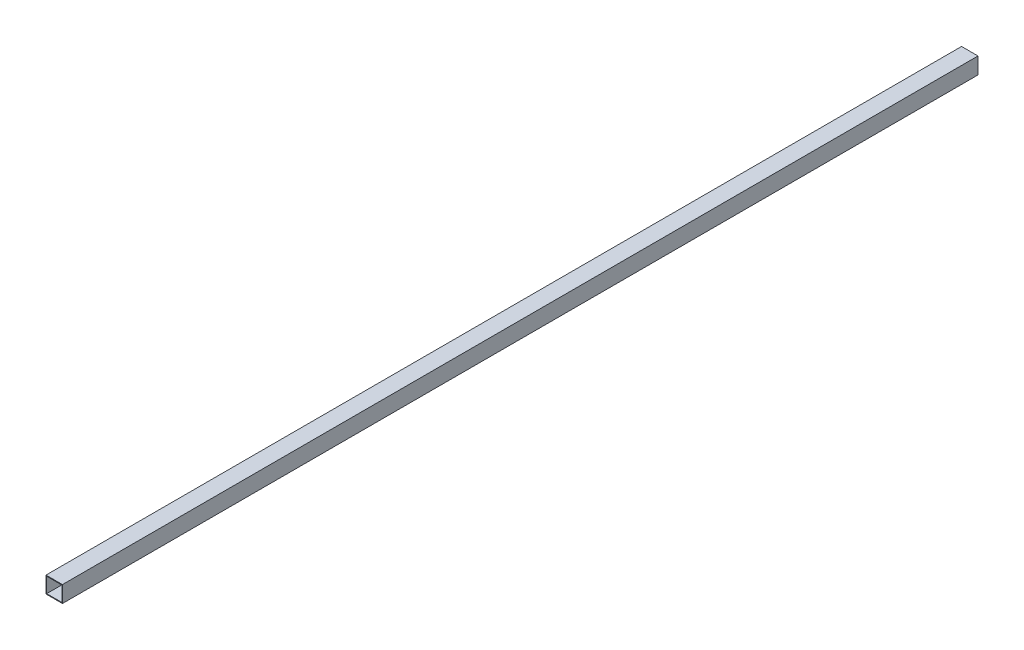
from build123d import *

# Parameters (mm, degrees)
SKETCH2_W           = 38.1
SKETCH2_H           = 38.1
SKETCH2_W_2         = 34.925
SKETCH2_H_2         = 34.925
BOSS_EXTRUDE1_DEPTH = 2120.9


with BuildPart() as part:
    # Sketch2 → Boss-Extrude1 (new body)
    with BuildSketch(Plane.XY):
        with Locations((19.05, 19.05)):
            Rectangle(SKETCH2_W, SKETCH2_H)
        with Locations((19.05, 19.05)):
            Rectangle(SKETCH2_W_2, SKETCH2_H_2, mode=Mode.SUBTRACT)
    extrude(amount=BOSS_EXTRUDE1_DEPTH)


solid = part.part
